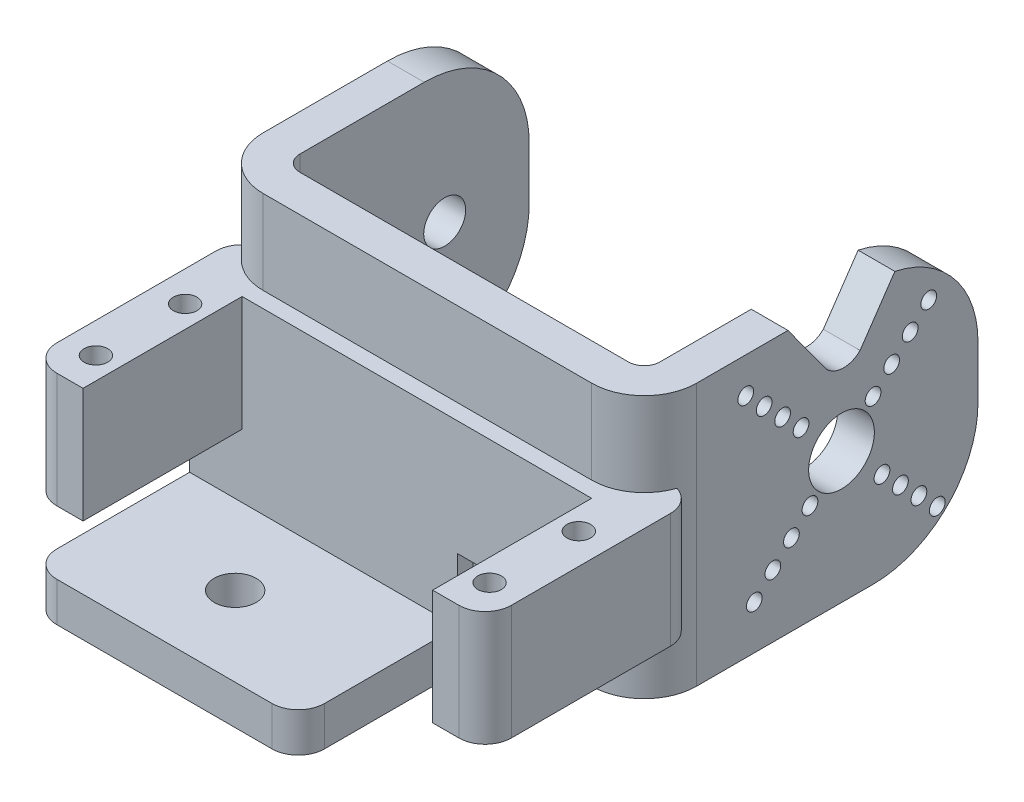
from build123d import *

# Parameters (mm, degrees)
BOSS_EXTRUDE1_DEPTH      = 50
FILLET2_R                = 20
SKETCH6_R                = 1.5
CUT_EXTRUDE2_DEPTH       = 28.4
CUT_EXTRUDE3_DEPTH       = 136.4
CUT_EXTRUDE4_DEPTH       = 116.893533958
CUT_EXTRUDE4_DEPTH_BACK  = 26.4
BOSS_EXTRUDE2_DEPTH      = 21.9
BOSS_EXTRUDE3_DEPTH      = 12.1
BOSS_EXTRUDE4_DEPTH      = 7.5
CUT_EXTRUDE5_START       = 12.1
CUT_EXTRUDE5_OUTLINE_R   = 2.25
CUT_EXTRUDE5_DEPTH       = 21.9
CUT_EXTRUDE5_START_2     = -7.5
CUT_EXTRUDE5_2_OUTLINE_R = 4
CUT_EXTRUDE5_2_DEPTH     = 7.5


# Read off the part's stored shape, not the designer's step: Cut-Extrude5
with BuildPart() as part:
    # Sketch1 → Boss-Extrude1 (new body)
    with BuildSketch(Plane(origin=(0, 0, 0), x_dir=(1, 0, 0), z_dir=(0, 1, 0))):
        with BuildLine():
            Line((-56.375697839, 54.197981352), (-56.375697839, 10.497981352))
            ThreePointArc((-56.375697839, 10.497981352), (-53.44676565, 3.42691354), (-46.375697839, 0.497981352))
            Line((-46.375697839, 0.497981352), (16.224302161, 0.497981352))
            ThreePointArc((16.224302161, 0.497981352), (23.295369973, 3.42691354), (26.224302161, 10.497981352))
            Line((26.224302161, 10.497981352), (26.224302161, 64.097981352))
            Line((26.224302161, 64.097981352), (19.224302161, 64.097981352))
            Line((19.224302161, 64.097981352), (19.224302161, 10.497981352))
            ThreePointArc((19.224302161, 10.497981352), (18.345622505, 8.376661008), (16.224302161, 7.497981352))
            Line((16.224302161, 7.497981352), (-46.375697839, 7.497981352))
            ThreePointArc((-46.375697839, 7.497981352), (-48.497018182, 8.376661008), (-49.375697839, 10.497981352))
            Line((-49.375697839, 10.497981352), (-49.375697839, 54.197981352))
            Line((-49.375697839, 54.197981352), (-56.375697839, 54.197981352))
        make_face()
    extrude(amount=BOSS_EXTRUDE1_DEPTH)

    # Fillet2
    fillet2_edges = [part.edges().sort_by_distance(p)[0] for p in [
        (22.724302161, 0, -64.097981352),
        (-52.875697839, 0, -54.197981352),
        (22.724302161, 50, -64.097981352),
        (-52.875697839, 50, -54.197981352),
    ]]
    fillet(fillet2_edges, radius=FILLET2_R)

    # Sketch6 → Cut-Extrude2 (cut)
    with BuildSketch(Plane(origin=(26.224302161, 0, 0), x_dir=(0, 0, -1), z_dir=(1, 0, 0))):
        with BuildLine():
            ThreePointArc((34.097981352, 25), (38.097981352, 21), (42.097981352, 25))
            Line((42.097981352, 25), (34.097981352, 25))
        make_face()
        with BuildLine():
            Line((34.097981352, 25), (42.097981352, 25))
            ThreePointArc((42.097981352, 25), (38.097981352, 29), (34.097981352, 25))
        make_face()
        with BuildLine():
            ThreePointArc((31.836343923, 25), (38.097981352, 18.738362572), (44.35961878, 25))
            Line((44.35961878, 25), (42.097981352, 25))
            ThreePointArc((42.097981352, 25), (38.097981352, 21), (34.097981352, 25))
            Line((34.097981352, 25), (31.836343923, 25))
        make_face()
        with BuildLine():
            Line((42.097981352, 25), (44.35961878, 25))
            ThreePointArc((44.35961878, 25), (38.097981352, 31.261637428), (31.836343923, 25))
            Line((31.836343923, 25), (34.097981352, 25))
            ThreePointArc((34.097981352, 25), (38.097981352, 29), (42.097981352, 25))
        make_face()
        with Locations((30.390517437, 32.707463915)):
            Circle(SKETCH6_R)
        with Locations((26.876196734, 36.221784617)):
            Circle(SKETCH6_R)
        with Locations((23.354804964, 39.743176388)):
            Circle(SKETCH6_R)
        with Locations((19.854626397, 43.243354955)):
            Circle(SKETCH6_R)
        with Locations((44.108388992, 31.01040764)):
            Circle(SKETCH6_R)
        with Locations((47.643922898, 34.545941546)):
            Circle(SKETCH6_R)
        with Locations((51.179456803, 38.081475452)):
            Circle(SKETCH6_R)
        with Locations((54.714990709, 41.617009358)):
            Circle(SKETCH6_R)
        with Locations((45.805445266, 17.292536085)):
            Circle(SKETCH6_R)
        with Locations((49.319765969, 13.778215383)):
            Circle(SKETCH6_R)
        with Locations((52.841157739, 10.256823612)):
            Circle(SKETCH6_R)
        with Locations((56.341336306, 6.756645045)):
            Circle(SKETCH6_R)
        with Locations((32.087573711, 18.98959236)):
            Circle(SKETCH6_R)
        with Locations((28.552039805, 15.454058454)):
            Circle(SKETCH6_R)
        with Locations((25.0165059, 11.918524548)):
            Circle(SKETCH6_R)
        with Locations((21.480971994, 8.382990642)):
            Circle(SKETCH6_R)
    extrude(amount=-CUT_EXTRUDE2_DEPTH, mode=Mode.SUBTRACT)

    # Sketch6<3> → Cut-Extrude3 (cut)
    with BuildSketch(Plane(origin=(26.224302161, 0, 0), x_dir=(0, 0, -1), z_dir=(1, 0, 0))):
        with BuildLine():
            ThreePointArc((34.097981352, 25), (38.097981352, 21), (42.097981352, 25))
            Line((42.097981352, 25), (34.097981352, 25))
        make_face()
        with BuildLine():
            Line((34.097981352, 25), (42.097981352, 25))
            ThreePointArc((42.097981352, 25), (38.097981352, 29), (34.097981352, 25))
        make_face()
    extrude(amount=-CUT_EXTRUDE3_DEPTH, mode=Mode.SUBTRACT)

    # Sketch7 → Cut-Extrude4 (cut, two sides: drawn at the far end of the back side and taken through both)
    with BuildSketch(Plane(origin=(26.224302161, 0, 0), x_dir=(0, 0, -1), z_dir=(1, 0, 0)).offset(-CUT_EXTRUDE4_DEPTH_BACK)):
        with BuildLine():
            Line((44.097981352, 50), (27.901409821, 50))
            Line((27.901409821, 50), (34.889942889, 40.363586132))
            ThreePointArc((34.889942889, 40.363586132), (38.136702541, 38.542544558), (41.629478365, 39.830239282))
            Line((41.629478365, 39.830239282), (48.26230961, 49.561655609))
            ThreePointArc((48.26230961, 49.561655609), (46.191648926, 49.890112018), (44.097981352, 50))
        make_face()
    extrude(amount=CUT_EXTRUDE4_DEPTH + CUT_EXTRUDE4_DEPTH_BACK, mode=Mode.SUBTRACT)

    # Sketch8 → Boss-Extrude2 (add)
    with BuildSketch(Plane(origin=(0, 34, 0), x_dir=(1, 0, 0), z_dir=(0, 1, 0))):
        with BuildLine():
            Line((-52.375697839, 7.497981352), (24.224302161, 7.497981352))
            ThreePointArc((24.224302161, 7.497981352), (27.759836067, 6.033515257), (29.224302161, 2.497981352))
            Line((29.224302161, 2.497981352), (29.224302161, -27.802018648))
            ThreePointArc((29.224302161, -27.802018648), (27.759836067, -31.337552554), (24.224302161, -32.802018648))
            Line((24.224302161, -32.802018648), (19.224302161, -32.802018648))
            Line((19.224302161, -32.802018648), (19.224302161, -2.502018648))
            Line((19.224302161, -2.502018648), (-47.375697839, -2.502018648))
            Line((-47.375697839, -2.502018648), (-47.375697839, -32.802018648))
            Line((-47.375697839, -32.802018648), (-52.375697839, -32.802018648))
            ThreePointArc((-52.375697839, -32.802018648), (-55.911231744, -31.337552554), (-57.375697839, -27.802018648))
            Line((-57.375697839, -27.802018648), (-57.375697839, 2.497981352))
            ThreePointArc((-57.375697839, 2.497981352), (-55.911231744, 6.033515257), (-52.375697839, 7.497981352))
        make_face()
    extrude(amount=-BOSS_EXTRUDE2_DEPTH)

    # Sketch9 → Boss-Extrude3 (add)
    with BuildSketch(Plane.XZ.offset(-12.1)):
        with BuildLine():
            Line((-6.375697839, 2.502018648), (-47.375697839, 2.502018648))
            Line((-47.375697839, 2.502018648), (-57.375697839, 2.502018648))
            Line((-57.375697839, 2.502018648), (-57.375697839, -2.497981352))
            ThreePointArc((-57.375697839, -2.497981352), (-56.882077579, -4.664208864), (-55.498681185, -6.402718861))
            ThreePointArc((-55.498681185, -6.402718861), (-51.809268262, -2.102964231), (-46.375697839, -0.497981352))
            Line((-46.375697839, -0.497981352), (-6.375697839, -0.497981352))
            Line((-6.375697839, -0.497981352), (-6.375697839, 2.502018648))
        make_face()
    extrude(amount=BOSS_EXTRUDE3_DEPTH)

    # Sketch10 → Boss-Extrude4 (add)
    with BuildSketch(Plane.XZ):
        with BuildLine():
            ThreePointArc((-6.375697839, 27.802018648), (-7.840163933, 31.337552554), (-11.375697839, 32.802018648))
            Line((-11.375697839, 32.802018648), (-52.375697839, 32.802018648))
            ThreePointArc((-52.375697839, 32.802018648), (-55.911231744, 31.337552554), (-57.375697839, 27.802018648))
            Line((-57.375697839, 27.802018648), (-57.375697839, -2.497981352))
            ThreePointArc((-57.375697839, -2.497981352), (-55.911231744, -6.033515257), (-52.375697839, -7.497981352))
            Line((-52.375697839, -7.497981352), (-11.375697839, -7.497981352))
            ThreePointArc((-11.375697839, -7.497981352), (-7.840163933, -6.033515257), (-6.375697839, -2.497981352))
            Line((-6.375697839, -2.497981352), (-6.375697839, 27.802018648))
        make_face()
    extrude(amount=BOSS_EXTRUDE4_DEPTH)

    # Cut-Extrude5 outline → Cut-Extrude5 (cut)
    with BuildSketch(Plane(origin=(0, 0, 0), x_dir=(1, 0, 0), z_dir=(0, 1, 0)).offset(CUT_EXTRUDE5_START)):
        with Locations((23.424302161, -26.152018648)):
            Circle(CUT_EXTRUDE5_OUTLINE_R)
        with Locations((23.424302161, -9.152018648)):
            Circle(CUT_EXTRUDE5_OUTLINE_R)
        with Locations((-51.575697839, -9.152018648)):
            Circle(CUT_EXTRUDE5_OUTLINE_R)
        with Locations((-51.575697839, -26.152018648)):
            Circle(CUT_EXTRUDE5_OUTLINE_R)
    extrude(amount=CUT_EXTRUDE5_DEPTH, mode=Mode.SUBTRACT)

    # Cut-Extrude5 2 outline → Cut-Extrude5 2 (cut)
    with BuildSketch(Plane(origin=(0, 0, 0), x_dir=(1, 0, 0), z_dir=(0, 1, 0)).offset(CUT_EXTRUDE5_START_2)):
        with Locations((-33.547970659, -17.65072745)):
            Circle(CUT_EXTRUDE5_2_OUTLINE_R)
    extrude(amount=CUT_EXTRUDE5_2_DEPTH, mode=Mode.SUBTRACT)


solid = part.part
